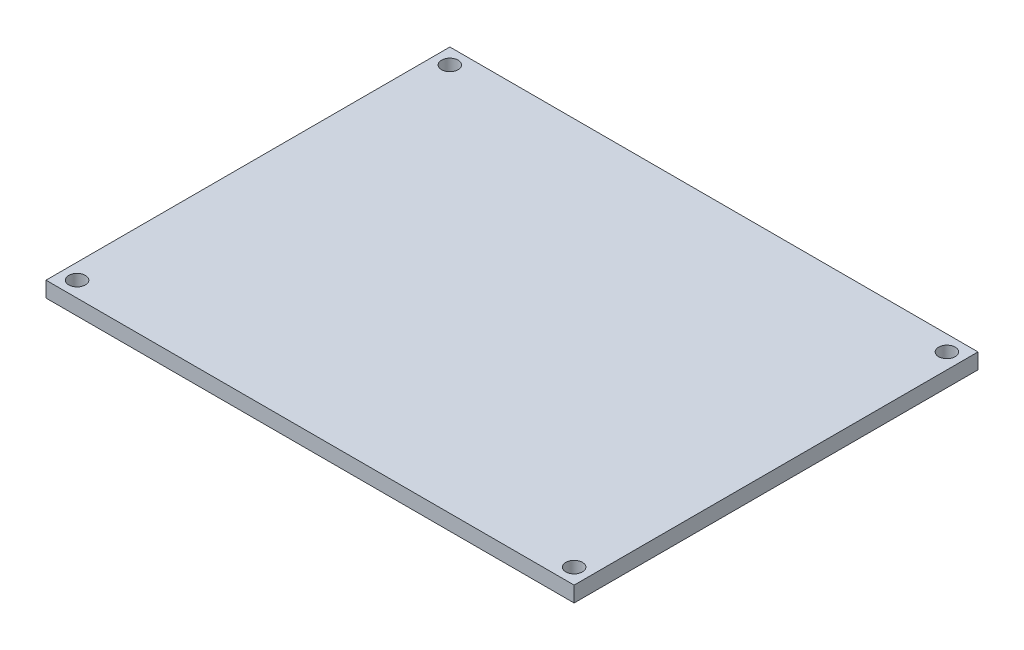
from build123d import *

# Parameters (mm, degrees)
SKETCH1_W            = 107.95
SKETCH1_H            = 82.55
BOSS_EXTRUDE1_DEPTH  = 3.175
M3_CLEARANCE_HOLE1_D = 3.4


with BuildPart() as part:
    # Sketch1 → Boss-Extrude1 (new body)
    with BuildSketch(Plane(origin=(0, 0, 0), x_dir=(1, 0, 0), z_dir=(0, 1, 0))):
        Rectangle(SKETCH1_W, SKETCH1_H)
    extrude(amount=BOSS_EXTRUDE1_DEPTH)

    # M3 Clearance Hole1 (through all)
    with Locations(Plane(origin=(-50.8, 0, 38.1), x_dir=(0, 0, -1), z_dir=(0, -1, 0))):
        with Locations((0, 0), (0, 101.6), (76.2, 0), (76.2, 101.6)):
            Hole(M3_CLEARANCE_HOLE1_D / 2)


solid = part.part
